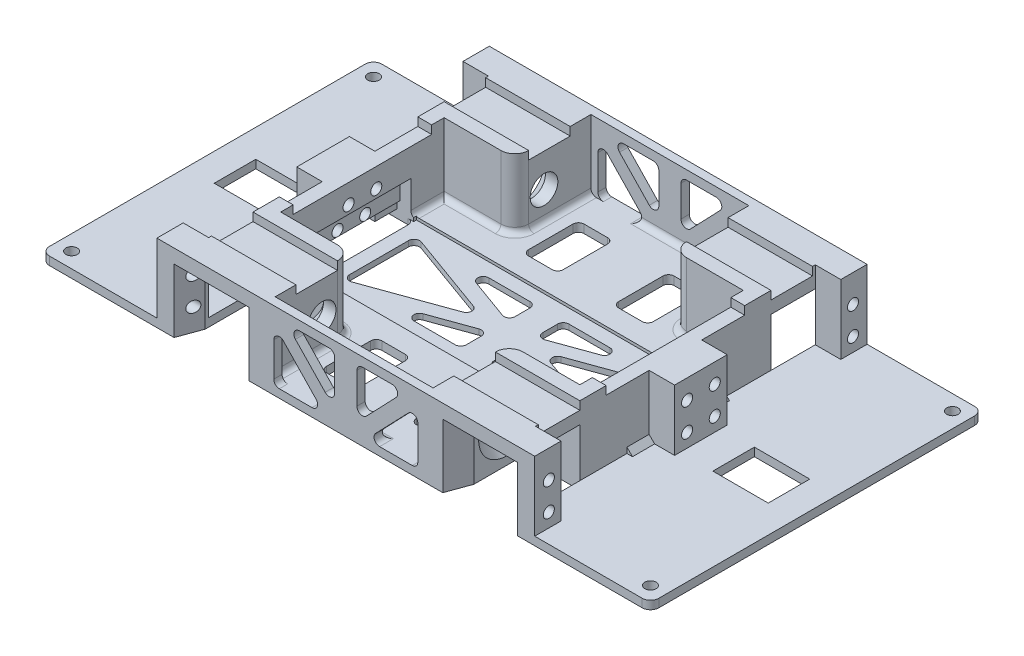
from build123d import *

# Parameters (mm, degrees)
EXTRUDE_1_DEPTH          = 3
SKETCH_9_W               = 106
SKETCH_9_H               = 37
CUT_EXTRUDE_5_DEPTH      = 1
SKETCH_2_W               = 9.2
SKETCH_2_H               = 9.5
EXTRUDE_2_DEPTH          = 25
CUT_EXTRUDE_1_DEPTH      = 129.390030766
CUT_EXTRUDE_1_DEPTH_BACK = 129.390030766
SKETCH_4_R               = 2
SKETCH_6_R               = 5
CUT_EXTRUDE_2_DEPTH      = 45
CUT_EXTRUDE_3_REACH      = 192.103
SKETCH_7_R               = 2
CUT_EXTRUDE_4_REACH      = 192.103
SKETCH_8_R               = 2
CUT_EXTRUDE_6_DEPTH      = 12
CUT_EXTRUDE_6_DEPTH_BACK = 128.769323392
SKETCH_10_W              = 5
SKETCH_10_H              = 35
SKETCH_11_R              = 2.05
SKETCH_11_W              = 12.5
SKETCH_11_H              = 20
SKETCH_11_W_2            = 20
SKETCH_11_H_2            = 15
CUT_EXTRUDE_7_DEPTH      = 128.769323392
SKETCH_12_W              = 30.5
SKETCH_12_H              = 30.5
EXTRUDE_3_DEPTH          = 5
CUT_EXTRUDE_8_DEPTH      = 129.390030766
CUT_EXTRUDE_8_DEPTH_BACK = 129.390030766
SKETCH_14_W              = 30.5
SKETCH_14_H              = 20
EXTRUDE_8_DEPTH          = 7.5
SKETCH_15_W              = 120
SKETCH_15_H              = 15
SKETCH_15_W_2            = 136.4
SKETCH_15_H_2            = 50
CUT_EXTRUDE_9_DEPTH      = 3
CHAMFER_1_SIZE           = 5
FILLET_1_R               = 3
CHAMFER_2_SIZE           = 6
CHAMFER_3_SIZE           = 8.242432258
CHAMFER_3_SIZE_2         = 3
FILLET_2_R               = 5
FILLET_3_R               = 2


# Some blends are built 0.0001 mm under size
with BuildPart() as part:
    # 草圖1 → 填料-伸長1 (new body)
    with BuildSketch(Plane(origin=(0, 0, 0), x_dir=(1, 0, 0), z_dir=(0, 1, 0))):
        Polygon((-110, -60), (-59, -60), (-59, -34.5), (-38, -34.5), (-38, -60), (38, -60), (38, -34.5), (59, -34.5), (59, -60), (110, -60), (110, 60), (59, 60), (59, 34.5), (38, 34.5), (38, 60), (-38, 60), (-38, 34.5), (-59, 34.5), (-59, 60), (-110, 60), align=None)
    extrude(amount=EXTRUDE_1_DEPTH)

    # 草圖9 → 除料-伸長5 (cut)
    with BuildSketch(Plane(origin=(0, 3, 0), x_dir=(1, 0, 0), z_dir=(0, 1, 0))):
        Rectangle(SKETCH_9_W, SKETCH_9_H)
    extrude(amount=-CUT_EXTRUDE_5_DEPTH, mode=Mode.SUBTRACT)

    # 草圖2 → 填料-伸長2 (add)
    # profile 1 of 5: a face of its own
    with BuildSketch(Plane(origin=(0, 3, 0), x_dir=(1, 0, 0), z_dir=(0, 1, 0))):
        Polygon((-59, 34.5), (-59, 9.5), (-68.2, 9.5), (-68.2, -9.5), (-59, -9.5), (-59, -34.5), (-38, -34.5), (-38, -60), (38, -60), (38, -34.5), (59, -34.5), (59, -9.5), (68.2, -9.5), (68.2, 9.5), (59, 9.5), (59, 34.5), (38, 34.5), (38, 60), (-38, 60), (-38, 34.5), align=None)
        Polygon((-28.5, 57), (28.5, 57), (28.5, 29.5), (54, 29.5), (54, -29.5), (28.5, -29.5), (28.5, -57), (-28.5, -57), (-28.5, -29.5), (-54, -29.5), (-54, 29.5), (-28.5, 29.5), align=None, mode=Mode.SUBTRACT)
    # profile 2 of 5: a face of its own
    with BuildSketch(Plane(origin=(0, 3, 0), x_dir=(1, 0, 0), z_dir=(0, 1, 0))):
        with Locations((-63.6, 55.25)):
            Rectangle(SKETCH_2_W, SKETCH_2_H)
    # profile 3 of 5: a face of its own
    with BuildSketch(Plane(origin=(0, 3, 0), x_dir=(1, 0, 0), z_dir=(0, 1, 0))):
        with Locations((63.6, 55.25)):
            Rectangle(SKETCH_2_W, SKETCH_2_H)
    # profile 4 of 5: a face of its own
    with BuildSketch(Plane(origin=(0, 3, 0), x_dir=(1, 0, 0), z_dir=(0, 1, 0))):
        with Locations((63.6, -55.25)):
            Rectangle(SKETCH_2_W, SKETCH_2_H)
    # profile 5 of 5: a face of its own
    with BuildSketch(Plane(origin=(0, 3, 0), x_dir=(1, 0, 0), z_dir=(0, 1, 0))):
        with Locations((-63.6, -55.25)):
            Rectangle(SKETCH_2_W, SKETCH_2_H)
    extrude(amount=EXTRUDE_2_DEPTH)

    # 草圖4 → 除料-伸長1 (cut, two sides: drawn at the far end of the back side and taken through both)
    with BuildSketch(Plane(origin=(0, 0, 0), x_dir=(0, 0, -1), z_dir=(1, 0, 0)).offset(-CUT_EXTRUDE_1_DEPTH_BACK)):
        with Locations(Location((-5, 18, 0), (0, 0, 180))):
            Circle(SKETCH_4_R)
        with Locations(Location((-5, 8, 0), (0, 0, 180))):
            Circle(SKETCH_4_R)
        with Locations(Location((5, 8, 0), (0, 0, 180))):
            Circle(SKETCH_4_R)
        with Locations(Location((5, 18, 0), (0, 0, 180))):
            Circle(SKETCH_4_R)
    extrude(amount=CUT_EXTRUDE_1_DEPTH + CUT_EXTRUDE_1_DEPTH_BACK, mode=Mode.SUBTRACT)

    # 草圖6 → 除料-伸長2 (cut, symmetric)
    with BuildSketch(Plane(origin=(0, 0, 0), x_dir=(0, 0, -1), z_dir=(1, 0, 0))):
        with Locations((-40.05, 13)):
            Circle(SKETCH_6_R)
        with Locations((40.05, 13)):
            Circle(SKETCH_6_R)
    extrude(amount=CUT_EXTRUDE_2_DEPTH, both=True, mode=Mode.SUBTRACT)

    # 草圖7 → 除料-伸長3 (cut, up to next)
    with BuildSketch(Plane.ZY.offset(68.2), mode=Mode.PRIVATE) as cut_extrude_3_sk1:
        with Locations((-54.9, 18)):
            Circle(SKETCH_7_R)
    cut_extrude_3_tool1 = extrude(cut_extrude_3_sk1.sketch, amount=-CUT_EXTRUDE_3_REACH, mode=Mode.PRIVATE) & part.part
    # 草圖7 → 除料-伸長3 (cut, up to next)
    with BuildSketch(Plane.ZY.offset(68.2), mode=Mode.PRIVATE) as cut_extrude_3_sk2:
        with Locations((-54.9, 8)):
            Circle(SKETCH_7_R)
    cut_extrude_3_tool2 = extrude(cut_extrude_3_sk2.sketch, amount=-CUT_EXTRUDE_3_REACH, mode=Mode.PRIVATE) & part.part
    # 草圖7 → 除料-伸長3 (cut, up to next)
    with BuildSketch(Plane.ZY.offset(68.2), mode=Mode.PRIVATE) as cut_extrude_3_sk3:
        with Locations((54.9, 8)):
            Circle(SKETCH_7_R)
    cut_extrude_3_tool3 = extrude(cut_extrude_3_sk3.sketch, amount=-CUT_EXTRUDE_3_REACH, mode=Mode.PRIVATE) & part.part
    # 草圖7 → 除料-伸長3 (cut, up to next)
    with BuildSketch(Plane.ZY.offset(68.2), mode=Mode.PRIVATE) as cut_extrude_3_sk4:
        with Locations((54.9, 18)):
            Circle(SKETCH_7_R)
    cut_extrude_3_tool4 = extrude(cut_extrude_3_sk4.sketch, amount=-CUT_EXTRUDE_3_REACH, mode=Mode.PRIVATE) & part.part
    add(cut_extrude_3_tool1.solids().sort_by_distance((-68.2, 18, -54.9))[0], mode=Mode.SUBTRACT)
    add(cut_extrude_3_tool2.solids().sort_by_distance((-68.2, 8, -54.9))[0], mode=Mode.SUBTRACT)
    add(cut_extrude_3_tool3.solids().sort_by_distance((-68.2, 8, 54.9))[0], mode=Mode.SUBTRACT)
    add(cut_extrude_3_tool4.solids().sort_by_distance((-68.2, 18, 54.9))[0], mode=Mode.SUBTRACT)

    # 草圖8 → 除料-伸長4 (cut, up to next)
    with BuildSketch(Plane(origin=(68.2, 0, 0), x_dir=(0, 0, -1), z_dir=(1, 0, 0)), mode=Mode.PRIVATE) as cut_extrude_4_sk1:
        with Locations(Location((54.9, 18, 0), (0, 0, 180))):
            Circle(SKETCH_8_R)
    cut_extrude_4_tool1 = extrude(cut_extrude_4_sk1.sketch, amount=-CUT_EXTRUDE_4_REACH, mode=Mode.PRIVATE) & part.part
    # 草圖8 → 除料-伸長4 (cut, up to next)
    with BuildSketch(Plane(origin=(68.2, 0, 0), x_dir=(0, 0, -1), z_dir=(1, 0, 0)), mode=Mode.PRIVATE) as cut_extrude_4_sk2:
        with Locations(Location((54.9, 8, 0), (0, 0, 180))):
            Circle(SKETCH_8_R)
    cut_extrude_4_tool2 = extrude(cut_extrude_4_sk2.sketch, amount=-CUT_EXTRUDE_4_REACH, mode=Mode.PRIVATE) & part.part
    # 草圖8 → 除料-伸長4 (cut, up to next)
    with BuildSketch(Plane(origin=(68.2, 0, 0), x_dir=(0, 0, -1), z_dir=(1, 0, 0)), mode=Mode.PRIVATE) as cut_extrude_4_sk3:
        with Locations(Location((-54.9, 8, 0), (0, 0, 180))):
            Circle(SKETCH_8_R)
    cut_extrude_4_tool3 = extrude(cut_extrude_4_sk3.sketch, amount=-CUT_EXTRUDE_4_REACH, mode=Mode.PRIVATE) & part.part
    # 草圖8 → 除料-伸長4 (cut, up to next)
    with BuildSketch(Plane(origin=(68.2, 0, 0), x_dir=(0, 0, -1), z_dir=(1, 0, 0)), mode=Mode.PRIVATE) as cut_extrude_4_sk4:
        with Locations(Location((-54.9, 18, 0), (0, 0, 180))):
            Circle(SKETCH_8_R)
    cut_extrude_4_tool4 = extrude(cut_extrude_4_sk4.sketch, amount=-CUT_EXTRUDE_4_REACH, mode=Mode.PRIVATE) & part.part
    add(cut_extrude_4_tool1.solids().sort_by_distance((68.2, 18, -54.9))[0], mode=Mode.SUBTRACT)
    add(cut_extrude_4_tool2.solids().sort_by_distance((68.2, 8, -54.9))[0], mode=Mode.SUBTRACT)
    add(cut_extrude_4_tool3.solids().sort_by_distance((68.2, 8, 54.9))[0], mode=Mode.SUBTRACT)
    add(cut_extrude_4_tool4.solids().sort_by_distance((68.2, 18, 54.9))[0], mode=Mode.SUBTRACT)

    # 草圖10 → 除料-伸長6 (cut, two sides: drawn at the far end of the back side and taken through both)
    with BuildSketch(Plane(origin=(0, 3, 0), x_dir=(1, 0, 0), z_dir=(0, 1, 0)).offset(-CUT_EXTRUDE_6_DEPTH_BACK)):
        with Locations((-55.5, 0)):
            Rectangle(SKETCH_10_W, SKETCH_10_H)
        with Locations((55.5, 0)):
            Rectangle(SKETCH_10_W, SKETCH_10_H)
    extrude(amount=CUT_EXTRUDE_6_DEPTH + CUT_EXTRUDE_6_DEPTH_BACK, mode=Mode.SUBTRACT)

    # 草圖11 → 除料-伸長7 (cut, through all)
    with BuildSketch(Plane(origin=(0, 3, 0), x_dir=(1, 0, 0), z_dir=(0, 1, 0))):
        with Locations(Location((104.5, 54.5, 0), (0, 0, 270))):
            Circle(SKETCH_11_R)
        with Locations(Location((-104.5, 54.5, 0), (0, 0, 90))):
            Circle(SKETCH_11_R)
        with Locations(Location((-104.5, -54.5, 0), (0, 0, 270))):
            Circle(SKETCH_11_R)
        with Locations(Location((104.5, -54.5, 0), (0, 0, 90))):
            Circle(SKETCH_11_R)
        Polygon((-48, 13.5), (-48, -13.5), (-10.631434842, 0), align=None)
        Polygon((-33.284314696, 13.5), (-5, 13.5), (-5, 3.281832758), align=None)
        Polygon((48, -13.5), (10.631434842, 0), (48, 13.5), align=None)
        Polygon((5, 13.5), (5, 3.281832758), (33.284314696, 13.5), align=None)
        Polygon((33.284314696, -13.5), (5, -13.5), (5, -3.281832758), align=None)
        Polygon((-5, -13.5), (-5, -3.281832758), (-33.284314696, -13.5), align=None)
        with Locations((16.25, 36.5)):
            Rectangle(SKETCH_11_W, SKETCH_11_H)
        with Locations((-16.25, 36.5)):
            Rectangle(SKETCH_11_W, SKETCH_11_H)
        with Locations((16.25, -36.5)):
            Rectangle(SKETCH_11_W, SKETCH_11_H)
        with Locations((-16.25, -36.5)):
            Rectangle(SKETCH_11_W, SKETCH_11_H)
        with Locations((-90, 0)):
            Rectangle(SKETCH_11_W_2, SKETCH_11_H_2)
        with Locations((90, 0)):
            Rectangle(SKETCH_11_W_2, SKETCH_11_H_2)
    extrude(amount=-CUT_EXTRUDE_7_DEPTH, mode=Mode.SUBTRACT)

    # 草圖12 → 填料-伸長3 (add)
    with BuildSketch(Plane(origin=(0, 28, 0), x_dir=(1, 0, 0), z_dir=(0, 1, 0))):
        with Locations((-43.75, 44.75)):
            Rectangle(SKETCH_12_W, SKETCH_12_H)
        with Locations((43.75, 44.75)):
            Rectangle(SKETCH_12_W, SKETCH_12_H)
        with Locations((43.75, -44.75)):
            Rectangle(SKETCH_12_W, SKETCH_12_H)
        with Locations((-43.75, -44.75)):
            Rectangle(SKETCH_12_W, SKETCH_12_H)
    extrude(amount=-EXTRUDE_3_DEPTH)

    # 草圖13 → 除料-伸長8 (cut, two sides: drawn at the far end of the back side and taken through both)
    with BuildSketch(Plane.XY.offset(-CUT_EXTRUDE_8_DEPTH_BACK)):
        Polygon((-26, 22.289181843), (-26, 3), (-7.5, 3), align=None)
        Polygon((-21.42413926, 24.741584836), (-4, 6.574158315), (-4, 24.741584836), align=None)
        Polygon((26, 3), (7.5, 3), (26, 22.289181843), align=None)
        Polygon((4, 6.574158315), (4, 24.741584836), (21.42413926, 24.741584836), align=None)
    extrude(amount=CUT_EXTRUDE_8_DEPTH + CUT_EXTRUDE_8_DEPTH_BACK, mode=Mode.SUBTRACT)

    # 草圖14 → 填料-伸長8 (add)
    with BuildSketch(Plane(origin=(0, 28, 0), x_dir=(1, 0, 0), z_dir=(0, 1, 0))):
        with Locations((-43.75, 42.5)):
            Rectangle(SKETCH_14_W, SKETCH_14_H)
        with Locations((43.75, 42.5)):
            Rectangle(SKETCH_14_W, SKETCH_14_H)
        with Locations((43.75, -42.5)):
            Rectangle(SKETCH_14_W, SKETCH_14_H)
        with Locations((-43.75, -42.5)):
            Rectangle(SKETCH_14_W, SKETCH_14_H)
    extrude(amount=-EXTRUDE_8_DEPTH)

    # 草圖15 → 除料-伸長9 (cut)
    with BuildSketch(Plane(origin=(0, 28, 0), x_dir=(1, 0, 0), z_dir=(0, 1, 0))):
        with Locations((0, 42)):
            Rectangle(SKETCH_15_W, SKETCH_15_H)
        with Locations((0, -42)):
            Rectangle(SKETCH_15_W, SKETCH_15_H)
        Rectangle(SKETCH_15_W_2, SKETCH_15_H_2)
    extrude(amount=-CUT_EXTRUDE_9_DEPTH, mode=Mode.SUBTRACT)

    # 導角1
    # the kernel refuses this chamfer: 5 mm, written as the material it takes off along each edge
    with BuildSketch(Plane(origin=(-38, 13, 40.05), x_dir=(0, 0, -1), z_dir=(0, -1, 0))) as chamfer_1_piece_1_section:
        Polygon((5 + CHAMFER_1_SIZE, 0), (5, CHAMFER_1_SIZE), (5, 0), align=None)
    chamfer_1_piece_1 = revolve(axis=Axis((-38, 13, 40.05), (1, 0, 0)), mode=Mode.PRIVATE)
    chamfer_1_piece_1 = split(chamfer_1_piece_1, bisect_by=Plane(origin=(-35.554314796, 20.5, 47.495685204), z_dir=(0, -1, 0)), keep=Keep.TOP, mode=Mode.PRIVATE)
    chamfer_1_piece_1 = split(chamfer_1_piece_1, bisect_by=Plane(origin=(-35.554314796, 13, 34.5), z_dir=(0, 0, 1)), keep=Keep.TOP, mode=Mode.PRIVATE)
    add(chamfer_1_piece_1, mode=Mode.SUBTRACT)
    with BuildSketch(Plane(origin=(38, 13, 40.05), x_dir=(0, 0, -1), z_dir=(0, -1, 0))) as chamfer_1_piece_2_section:
        Polygon((5 + CHAMFER_1_SIZE, 0), (5, -CHAMFER_1_SIZE), (5, 0), align=None)
    chamfer_1_piece_2 = revolve(axis=Axis((38, 13, 40.05), (1, 0, 0)), mode=Mode.PRIVATE)
    chamfer_1_piece_2 = split(chamfer_1_piece_2, bisect_by=Plane(origin=(35.554314796, 13, 34.5), z_dir=(0, 0, 1)), keep=Keep.TOP, mode=Mode.PRIVATE)
    chamfer_1_piece_2 = split(chamfer_1_piece_2, bisect_by=Plane(origin=(35.554314796, 20.5, 47.495685204), z_dir=(0, -1, 0)), keep=Keep.TOP, mode=Mode.PRIVATE)
    add(chamfer_1_piece_2, mode=Mode.SUBTRACT)
    with BuildSketch(Plane(origin=(38, 13, -40.05), x_dir=(0, 0, -1), z_dir=(0, -1, 0))) as chamfer_1_piece_3_section:
        Polygon((5 + CHAMFER_1_SIZE, 0), (5, -CHAMFER_1_SIZE), (5, 0), align=None)
    chamfer_1_piece_3 = revolve(axis=Axis((38, 13, -40.05), (1, 0, 0)), mode=Mode.PRIVATE)
    chamfer_1_piece_3 = split(chamfer_1_piece_3, bisect_by=Plane(origin=(35.554314793, 20.5, -43.772842603), z_dir=(0, -1, 0)), keep=Keep.TOP, mode=Mode.PRIVATE)
    chamfer_1_piece_3 = split(chamfer_1_piece_3, bisect_by=Plane(origin=(35.554314793, 19.448152538, -34.5), z_dir=(0, 0, -1)), keep=Keep.TOP, mode=Mode.PRIVATE)
    add(chamfer_1_piece_3, mode=Mode.SUBTRACT)
    with BuildSketch(Plane(origin=(-38, 13, -40.05), x_dir=(0, 0, -1), z_dir=(0, -1, 0))) as chamfer_1_piece_4_section:
        Polygon((5 + CHAMFER_1_SIZE, 0), (5, CHAMFER_1_SIZE), (5, 0), align=None)
    chamfer_1_piece_4 = revolve(axis=Axis((-38, 13, -40.05), (1, 0, 0)), mode=Mode.PRIVATE)
    chamfer_1_piece_4 = split(chamfer_1_piece_4, bisect_by=Plane(origin=(-35.554314793, 19.448152538, -34.5), z_dir=(0, 0, -1)), keep=Keep.TOP, mode=Mode.PRIVATE)
    chamfer_1_piece_4 = split(chamfer_1_piece_4, bisect_by=Plane(origin=(-35.554314793, 20.5, -43.772842604), z_dir=(0, -1, 0)), keep=Keep.TOP, mode=Mode.PRIVATE)
    add(chamfer_1_piece_4, mode=Mode.SUBTRACT)

    # 圓角1
    fillet_1_edges = [part.edges().sort_by_distance(p)[0] for p in [
        (110, 1.5, -60),
        (110, 1.5, 60),
        (-110, 1.5, 60),
        (-110, 1.5, -60),
    ]]
    fillet(fillet_1_edges, radius=FILLET_1_R)

    # 導角2
    chamfer_2_edges = [part.edges().sort_by_distance(p)[0] for p in [
        (-58, 0, 0),
        (58, 0, 0),
    ]]
    chamfer(chamfer_2_edges, length=CHAMFER_2_SIZE - 0.0001)  # a hair under: the kernel refuses the full size

    # 導角3
    # the kernel refuses this chamfer: 8.242432258, 3 mm, written as the material it takes off along each edge
    with BuildSketch(Plane(origin=(-38, -21.382474348, -60), x_dir=(-0.013184058198645472, 0, 0.9999130865277316), z_dir=(0, 1, 0))) as chamfer_3_piece_1_section:
        Polygon((CHAMFER_3_SIZE * 0.999913086572, CHAMFER_3_SIZE * 0.0131840581992), (-CHAMFER_3_SIZE_2 * 0.0131840581986, CHAMFER_3_SIZE_2 * 0.999913086528), (0, 0), align=None)
    chamfer_3_piece_1 = extrude(amount=65.764948696, mode=Mode.PRIVATE)
    chamfer_3_piece_1 = split(chamfer_3_piece_1, bisect_by=Plane(origin=(-37.909925586, 20.5, -52.252522581), z_dir=(0, -1, 0)), keep=Keep.TOP, mode=Mode.PRIVATE)
    add(chamfer_3_piece_1, mode=Mode.SUBTRACT)
    with BuildSketch(Plane(origin=(-38, -21.382474348, -60), x_dir=(-0.013184058198645472, 0, 0.9999130865277316), z_dir=(0, 1, 0))) as chamfer_3_piece_2_section:
        Polygon((CHAMFER_3_SIZE * 0.999913086572, CHAMFER_3_SIZE * 0.0131840581992), (-CHAMFER_3_SIZE_2 * 0.0131840581986, CHAMFER_3_SIZE_2 * 0.999913086528), (0, 0), align=None)
    chamfer_3_piece_2 = extrude(amount=44.382474348, mode=Mode.PRIVATE)
    chamfer_3_piece_2 = split(chamfer_3_piece_2, bisect_by=Plane(origin=(-36.992557022, 21.75, -52.5), z_dir=(0, 0, -1)), keep=Keep.TOP, mode=Mode.PRIVATE)
    add(chamfer_3_piece_2, mode=Mode.SUBTRACT)
    with BuildSketch(Plane(origin=(-59, 23, -60), x_dir=(0.013184058198645472, 0, 0.9999130865277316), z_dir=(0, -1, 0))) as chamfer_3_piece_3_section:
        Polygon((CHAMFER_3_SIZE * 0.999913086572, CHAMFER_3_SIZE * 0.0131840581992), (-CHAMFER_3_SIZE_2 * 0.0131840581986, CHAMFER_3_SIZE_2 * 0.999913086528), (0, 0), align=None)
    chamfer_3_piece_3 = extrude(amount=44.382474348, mode=Mode.PRIVATE)
    chamfer_3_piece_3 = split(chamfer_3_piece_3, bisect_by=Plane(origin=(-60.007442978, 21.75, -52.5), z_dir=(0, 0, -1)), keep=Keep.TOP, mode=Mode.PRIVATE)
    add(chamfer_3_piece_3, mode=Mode.SUBTRACT)
    with BuildSketch(Plane(origin=(-59, 44.382474348, -60), x_dir=(0.013184058198645472, 0, 0.9999130865277316), z_dir=(0, -1, 0))) as chamfer_3_piece_4_section:
        Polygon((CHAMFER_3_SIZE * 0.999913086572, CHAMFER_3_SIZE * 0.0131840581992), (-CHAMFER_3_SIZE_2 * 0.0131840581986, CHAMFER_3_SIZE_2 * 0.999913086528), (0, 0), align=None)
    chamfer_3_piece_4 = extrude(amount=65.764948696, mode=Mode.PRIVATE)
    chamfer_3_piece_4 = split(chamfer_3_piece_4, bisect_by=Plane(origin=(-59.090074414, 20.5, -52.252522581), z_dir=(0, -1, 0)), keep=Keep.TOP, mode=Mode.PRIVATE)
    add(chamfer_3_piece_4, mode=Mode.SUBTRACT)
    with BuildSketch(Plane(origin=(38, -21.382474348, -60), x_dir=(0.013184058198645472, 0, 0.9999130865277316), z_dir=(0, 1, 0))) as chamfer_3_piece_5_section:
        Polygon((CHAMFER_3_SIZE * 0.999913086572, -CHAMFER_3_SIZE * 0.0131840581992), (-CHAMFER_3_SIZE_2 * 0.0131840581986, -CHAMFER_3_SIZE_2 * 0.999913086528), (0, 0), align=None)
    chamfer_3_piece_5 = extrude(amount=65.764948696, mode=Mode.PRIVATE)
    chamfer_3_piece_5 = split(chamfer_3_piece_5, bisect_by=Plane(origin=(37.909925586, 20.5, -52.252522581), z_dir=(0, -1, 0)), keep=Keep.TOP, mode=Mode.PRIVATE)
    add(chamfer_3_piece_5, mode=Mode.SUBTRACT)
    with BuildSketch(Plane(origin=(38, -21.382474348, -60), x_dir=(0.013184058198645472, 0, 0.9999130865277316), z_dir=(0, 1, 0))) as chamfer_3_piece_6_section:
        Polygon((CHAMFER_3_SIZE * 0.999913086572, -CHAMFER_3_SIZE * 0.0131840581992), (-CHAMFER_3_SIZE_2 * 0.0131840581986, -CHAMFER_3_SIZE_2 * 0.999913086528), (0, 0), align=None)
    chamfer_3_piece_6 = extrude(amount=44.382474348, mode=Mode.PRIVATE)
    chamfer_3_piece_6 = split(chamfer_3_piece_6, bisect_by=Plane(origin=(36.992557022, 21.75, -52.5), z_dir=(0, 0, -1)), keep=Keep.TOP, mode=Mode.PRIVATE)
    add(chamfer_3_piece_6, mode=Mode.SUBTRACT)
    with BuildSketch(Plane(origin=(59, -21.382474348, -60), x_dir=(-0.013184058198645472, 0, 0.9999130865277316), z_dir=(0, 1, 0))) as chamfer_3_piece_7_section:
        Polygon((CHAMFER_3_SIZE * 0.999913086572, CHAMFER_3_SIZE * 0.0131840581992), (-CHAMFER_3_SIZE_2 * 0.0131840581986, CHAMFER_3_SIZE_2 * 0.999913086528), (0, 0), align=None)
    chamfer_3_piece_7 = extrude(amount=65.764948696, mode=Mode.PRIVATE)
    chamfer_3_piece_7 = split(chamfer_3_piece_7, bisect_by=Plane(origin=(59.090074414, 20.5, -52.252522581), z_dir=(0, -1, 0)), keep=Keep.TOP, mode=Mode.PRIVATE)
    add(chamfer_3_piece_7, mode=Mode.SUBTRACT)
    with BuildSketch(Plane(origin=(59, -21.382474348, -60), x_dir=(-0.013184058198645472, 0, 0.9999130865277316), z_dir=(0, 1, 0))) as chamfer_3_piece_8_section:
        Polygon((CHAMFER_3_SIZE * 0.999913086572, CHAMFER_3_SIZE * 0.0131840581992), (-CHAMFER_3_SIZE_2 * 0.0131840581986, CHAMFER_3_SIZE_2 * 0.999913086528), (0, 0), align=None)
    chamfer_3_piece_8 = extrude(amount=44.382474348, mode=Mode.PRIVATE)
    chamfer_3_piece_8 = split(chamfer_3_piece_8, bisect_by=Plane(origin=(60.007442978, 21.75, -52.5), z_dir=(0, 0, -1)), keep=Keep.TOP, mode=Mode.PRIVATE)
    add(chamfer_3_piece_8, mode=Mode.SUBTRACT)
    with BuildSketch(Plane(origin=(59, -21.382474348, 60), x_dir=(-0.013184058198645491, 0, -0.9999130865277314), z_dir=(0, 1, 0))) as chamfer_3_piece_9_section:
        Polygon((CHAMFER_3_SIZE * 0.999913086572, -CHAMFER_3_SIZE * 0.0131840581992), (-CHAMFER_3_SIZE_2 * 0.0131840581986, -CHAMFER_3_SIZE_2 * 0.999913086528), (0, 0), align=None)
    chamfer_3_piece_9 = extrude(amount=65.764948696, mode=Mode.PRIVATE)
    chamfer_3_piece_9 = split(chamfer_3_piece_9, bisect_by=Plane(origin=(59.090074414, 20.5, 52.252522581), z_dir=(0, -1, 0)), keep=Keep.TOP, mode=Mode.PRIVATE)
    add(chamfer_3_piece_9, mode=Mode.SUBTRACT)
    with BuildSketch(Plane(origin=(59, -21.382474348, 60), x_dir=(-0.013184058198645491, 0, -0.9999130865277314), z_dir=(0, 1, 0))) as chamfer_3_piece_10_section:
        Polygon((CHAMFER_3_SIZE * 0.999913086572, -CHAMFER_3_SIZE * 0.0131840581992), (-CHAMFER_3_SIZE_2 * 0.0131840581986, -CHAMFER_3_SIZE_2 * 0.999913086528), (0, 0), align=None)
    chamfer_3_piece_10 = extrude(amount=44.382474348, mode=Mode.PRIVATE)
    chamfer_3_piece_10 = split(chamfer_3_piece_10, bisect_by=Plane(origin=(60.007442978, 21.75, 52.5), z_dir=(0, 0, 1)), keep=Keep.TOP, mode=Mode.PRIVATE)
    add(chamfer_3_piece_10, mode=Mode.SUBTRACT)
    with BuildSketch(Plane(origin=(38, -21.382474348, 60), x_dir=(0.013184058198645491, 0, -0.9999130865277314), z_dir=(0, 1, 0))) as chamfer_3_piece_11_section:
        Polygon((CHAMFER_3_SIZE * 0.999913086572, CHAMFER_3_SIZE * 0.0131840581992), (-CHAMFER_3_SIZE_2 * 0.0131840581986, CHAMFER_3_SIZE_2 * 0.999913086528), (0, 0), align=None)
    chamfer_3_piece_11 = extrude(amount=65.764948696, mode=Mode.PRIVATE)
    chamfer_3_piece_11 = split(chamfer_3_piece_11, bisect_by=Plane(origin=(37.909925586, 20.5, 52.252522581), z_dir=(0, -1, 0)), keep=Keep.TOP, mode=Mode.PRIVATE)
    add(chamfer_3_piece_11, mode=Mode.SUBTRACT)
    with BuildSketch(Plane(origin=(38, -21.382474348, 60), x_dir=(0.013184058198645491, 0, -0.9999130865277314), z_dir=(0, 1, 0))) as chamfer_3_piece_12_section:
        Polygon((CHAMFER_3_SIZE * 0.999913086572, CHAMFER_3_SIZE * 0.0131840581992), (-CHAMFER_3_SIZE_2 * 0.0131840581986, CHAMFER_3_SIZE_2 * 0.999913086528), (0, 0), align=None)
    chamfer_3_piece_12 = extrude(amount=44.382474348, mode=Mode.PRIVATE)
    chamfer_3_piece_12 = split(chamfer_3_piece_12, bisect_by=Plane(origin=(36.992557022, 21.75, 52.5), z_dir=(0, 0, 1)), keep=Keep.TOP, mode=Mode.PRIVATE)
    add(chamfer_3_piece_12, mode=Mode.SUBTRACT)
    with BuildSketch(Plane(origin=(-38, -21.382474348, 60), x_dir=(-0.013184058198645491, 0, -0.9999130865277314), z_dir=(0, 1, 0))) as chamfer_3_piece_13_section:
        Polygon((CHAMFER_3_SIZE * 0.999913086572, -CHAMFER_3_SIZE * 0.0131840581992), (-CHAMFER_3_SIZE_2 * 0.0131840581986, -CHAMFER_3_SIZE_2 * 0.999913086528), (0, 0), align=None)
    chamfer_3_piece_13 = extrude(amount=65.764948696, mode=Mode.PRIVATE)
    chamfer_3_piece_13 = split(chamfer_3_piece_13, bisect_by=Plane(origin=(-37.909925586, 20.5, 52.252522581), z_dir=(0, -1, 0)), keep=Keep.TOP, mode=Mode.PRIVATE)
    add(chamfer_3_piece_13, mode=Mode.SUBTRACT)
    with BuildSketch(Plane(origin=(-38, -21.382474348, 60), x_dir=(-0.013184058198645491, 0, -0.9999130865277314), z_dir=(0, 1, 0))) as chamfer_3_piece_14_section:
        Polygon((CHAMFER_3_SIZE * 0.999913086572, -CHAMFER_3_SIZE * 0.0131840581992), (-CHAMFER_3_SIZE_2 * 0.0131840581986, -CHAMFER_3_SIZE_2 * 0.999913086528), (0, 0), align=None)
    chamfer_3_piece_14 = extrude(amount=44.382474348, mode=Mode.PRIVATE)
    chamfer_3_piece_14 = split(chamfer_3_piece_14, bisect_by=Plane(origin=(-36.992557022, 21.75, 52.5), z_dir=(0, 0, 1)), keep=Keep.TOP, mode=Mode.PRIVATE)
    add(chamfer_3_piece_14, mode=Mode.SUBTRACT)
    with BuildSketch(Plane(origin=(-59, -21.382474348, 60), x_dir=(0.013184058198645491, 0, -0.9999130865277314), z_dir=(0, 1, 0))) as chamfer_3_piece_15_section:
        Polygon((CHAMFER_3_SIZE * 0.999913086572, CHAMFER_3_SIZE * 0.0131840581992), (-CHAMFER_3_SIZE_2 * 0.0131840581986, CHAMFER_3_SIZE_2 * 0.999913086528), (0, 0), align=None)
    chamfer_3_piece_15 = extrude(amount=65.764948696, mode=Mode.PRIVATE)
    chamfer_3_piece_15 = split(chamfer_3_piece_15, bisect_by=Plane(origin=(-59.090074414, 20.5, 52.252522581), z_dir=(0, -1, 0)), keep=Keep.TOP, mode=Mode.PRIVATE)
    add(chamfer_3_piece_15, mode=Mode.SUBTRACT)
    with BuildSketch(Plane(origin=(-59, -21.382474348, 60), x_dir=(0.013184058198645491, 0, -0.9999130865277314), z_dir=(0, 1, 0))) as chamfer_3_piece_16_section:
        Polygon((CHAMFER_3_SIZE * 0.999913086572, CHAMFER_3_SIZE * 0.0131840581992), (-CHAMFER_3_SIZE_2 * 0.0131840581986, CHAMFER_3_SIZE_2 * 0.999913086528), (0, 0), align=None)
    chamfer_3_piece_16 = extrude(amount=44.382474348, mode=Mode.PRIVATE)
    chamfer_3_piece_16 = split(chamfer_3_piece_16, bisect_by=Plane(origin=(-60.007442978, 21.75, 52.5), z_dir=(0, 0, 1)), keep=Keep.TOP, mode=Mode.PRIVATE)
    add(chamfer_3_piece_16, mode=Mode.SUBTRACT)

    # 圓角2
    fillet_2_edges = [part.edges().sort_by_distance(p)[0] for p in [
        (-28.5, 15.5, 29.5),
        (-28.5, 15.5, -29.5),
        (28.5, 15.5, 29.5),
        (28.5, 15.5, -29.5),
    ]]
    fillet(fillet_2_edges, radius=FILLET_2_R)

    # 圓角3
    fillet_3_edges = [part.edges().sort_by_distance(p)[0] for p in [
        (-28.5, 3, -45.75),
        (-54, 3, -23.5),
        (-43.75, 3, 29.5),
        (0, 3, 57),
        (28.5, 3, 45.75),
        (54, 3, 23.5),
        (43.75, 3, -29.5),
        (-28.5, 3, 45.75),
        (-43.75, 3, -29.5),
        (43.75, 3, 29.5),
        (28.5, 3, -45.75),
        (-29.964466094, 3, 30.964466094),
        (-29.964466094, 3, -30.964466094),
        (29.964466094, 3, 30.964466094),
        (29.964466094, 3, -30.964466094),
        (-54, 3, 23.5),
        (54, 3, -23.5),
        (-53, 1, 17.5),
        (-53, 1, -17.5),
        (53, 1, -17.5),
        (53, 1, 17.5),
        (48, 1, -13.5),
        (48, 1, 13.5),
        (10.631434842, 1, 0),
        (5, 1, -13.5),
        (33.284314696, 1, -13.5),
        (5, 1, -3.281832758),
        (-5, 1, -3.281832758),
        (-33.284314696, 1, -13.5),
        (-5, 1, -13.5),
        (-48, 1, -13.5),
        (-10.631434842, 1, 0),
        (-48, 1, 13.5),
        (-22.5, 1.5, 46.5),
        (-22.5, 1.5, 26.5),
        (-10, 1.5, 26.5),
        (-10, 1.5, 46.5),
        (22.5, 1.5, 46.5),
        (10, 1.5, 46.5),
        (10, 1.5, 26.5),
        (22.5, 1.5, 26.5),
        (22.5, 1.5, -46.5),
        (22.5, 1.5, -26.5),
        (10, 1.5, -26.5),
        (10, 1.5, -46.5),
        (5, 1, 3.281832758),
        (33.284314696, 1, 13.5),
        (5, 1, 13.5),
        (-5, 1, 13.5),
        (-33.284314696, 1, 13.5),
        (-5, 1, 3.281832758),
        (-22.5, 1.5, -26.5),
        (-22.5, 1.5, -46.5),
        (-10, 1.5, -46.5),
        (-10, 1.5, -26.5),
        (0, 3, -57),
        (-21.42413926, 24.741584836, 58.5),
        (-4, 24.741584836, 58.5),
        (-4, 6.574158315, 58.5),
        (-21.42413926, 24.741584836, -58.5),
        (-4, 24.741584836, -58.5),
        (-4, 6.574158315, -58.5),
        (26, 22.289181843, 58.5),
        (7.5, 3, 58.5),
        (26, 3, -58.5),
        (26, 3, 58.5),
        (26, 22.289181843, -58.5),
        (7.5, 3, -58.5),
        (21.42413926, 24.741584836, 58.5),
        (4, 6.574158315, 58.5),
        (4, 24.741584836, 58.5),
        (21.42413926, 24.741584836, -58.5),
        (4, 6.574158315, -58.5),
        (4, 24.741584836, -58.5),
        (-26, 22.289181843, 58.5),
        (-26, 3, 58.5),
        (-7.5, 3, -58.5),
        (-7.5, 3, 58.5),
        (-26, 22.289181843, -58.5),
        (-26, 3, -58.5),
    ]]
    fillet(fillet_3_edges, radius=FILLET_3_R)


solid = part.part
